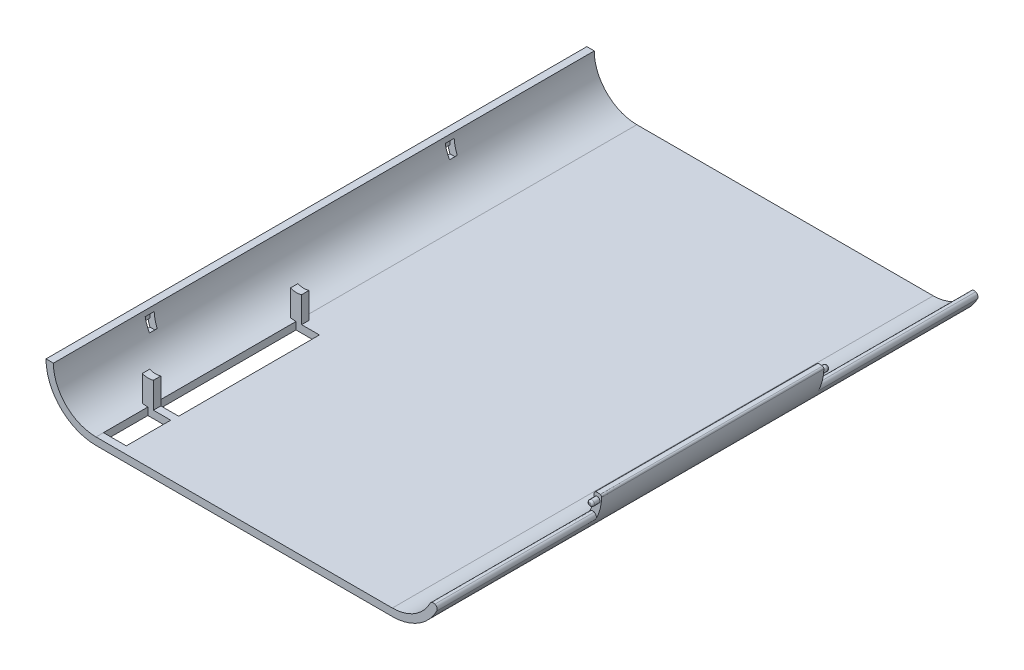
from build123d import *

# Parameters (mm, degrees)
BASE_DEPTH             = 146
HINGE_CUT_DEPTH        = 43
HINGE_START            = -103
HINGE_CUT_2_DEPTH      = 43
HINGE_START_2          = -62
SKETCH3_R              = 0.75
HINGE_EXTRUSIONS_DEPTH = 64
FILLET5_R              = 0.5
FILLET6_R              = 0.5
SYRINGE_START          = -92
SYRINGE_HOLDER_DEPTH   = 2
LPATTERN4_COUNT        = 2
LPATTERN4_PITCH        = 40
FILLET7_R              = 1
FILLET8_R              = 0.5
SNAP_START             = -12.431858348
SNAP_GROOVE1_DEPTH     = 2
SNAP_START_2           = -13.062831461
SNAP_GROOVE1_2_DEPTH   = 0.630973113
LPATTERN5_COUNT        = 2
LPATTERN5_PITCH        = 81
SKETCH6_W              = 6.31577628
SKETCH6_H              = 38
VISIBILITY_DEPTH       = 2
SKETCH7_W              = 6.177782062
SKETCH7_H              = 12
CUT_EXTRUDE4_DEPTH     = 2


# Read off the part's stored shape, not the designer's step: Snap Groove1
with BuildPart() as part:
    # Sketch1 → Base (new body)
    with BuildSketch(Plane.XY):
        with BuildLine():
            Line((0, 0), (80, 0))
            ThreePointArc((80, 0), (89.545941546, 3.954058454), (93.5, 13.5))
            ThreePointArc((93.5, 13.5), (92.5, 13.70219929), (91.5, 13.5))
            ThreePointArc((91.5, 13.5), (88.131727984, 5.368272016), (80, 2))
            Line((80, 2), (0, 2))
            ThreePointArc((0, 2), (-8.131727984, 5.368272016), (-11.5, 13.5))
            Line((-11.5, 13.5), (-13.5, 13.5))
            ThreePointArc((-13.5, 13.5), (-9.545941546, 3.954058454), (0, 0))
        make_face()
    extrude(amount=-BASE_DEPTH)

    # Sketch2 → Hinge cut (cut)
    with BuildSketch(Plane.XY):
        with BuildLine():
            ThreePointArc((93.5, 13.5), (93.179996096, 10.578065212), (92.235155125, 7.794653467))
            ThreePointArc((92.235155125, 7.794653467), (91.53133512, 8.651508178), (90.422539551, 8.63988999))
            ThreePointArc((90.422539551, 8.63988999), (91.227404082, 11.01094444), (91.5, 13.5))
            ThreePointArc((91.5, 13.5), (92.5, 13.914213562), (93.5, 13.5))
        make_face()
    extrude(amount=-HINGE_CUT_DEPTH, mode=Mode.SUBTRACT)

    # Sketch2<2> → Hinge cut 2 (cut)
    with BuildSketch(Plane.XY.offset(HINGE_START)):
        with BuildLine():
            ThreePointArc((93.5, 13.5), (93.179996096, 10.578065212), (92.235155125, 7.794653467))
            ThreePointArc((92.235155125, 7.794653467), (91.53133512, 8.651508178), (90.422539551, 8.63988999))
            ThreePointArc((90.422539551, 8.63988999), (91.227404082, 11.01094444), (91.5, 13.5))
            ThreePointArc((91.5, 13.5), (92.5, 13.914213562), (93.5, 13.5))
        make_face()
    extrude(amount=-HINGE_CUT_2_DEPTH, mode=Mode.SUBTRACT)

    # Sketch3 → hinge extrusions (add)
    with BuildSketch(Plane.XY.offset(-43).offset(HINGE_START_2)):
        with Locations(Location((92.3, 12, 0), (0, 0, 180))):
            Circle(SKETCH3_R)
    extrude(amount=HINGE_EXTRUSIONS_DEPTH)

    # Fillet5
    fillet5_edges = [part.edges().sort_by_distance(p)[0] for p in [
        (93.05, 12, -105),
    ]]
    fillet(fillet5_edges, radius=FILLET5_R)

    # Fillet6
    fillet6_edges = [part.edges().sort_by_distance(p)[0] for p in [
        (93.05, 12, -41),
    ]]
    fillet(fillet6_edges, radius=FILLET6_R)

    # Sketch5 → Syringe holder (add)
    with BuildSketch(Plane(origin=(0, 0, -146), x_dir=(-1, 0, 0), z_dir=(0, 0, -1)).offset(SYRINGE_START)):
        with BuildLine():
            Line((0, 2), (-1.5, 2))
            Line((-1.5, 2), (-1.5, 9))
            ThreePointArc((-1.5, 9), (0.0084764, 8.790290315), (1.5, 9.098245749))
            Line((1.5, 9.098245749), (1.5, 2.098245749))
            ThreePointArc((1.5, 2.098245749), (0.751606983, 2.024587722), (0, 2))
        make_face()
    syringe_holder = extrude(amount=SYRINGE_HOLDER_DEPTH)

    # LPattern4: Syringe holder ×2
    with Locations(*[(0, 0, i * LPATTERN4_PITCH) for i in range(1, LPATTERN4_COUNT)]):
        add(syringe_holder)

    # Fillet7
    fillet7_edges = [part.edges().sort_by_distance(p)[0] for p in [
        (92.235155125, 7.794653467, -21.5),
        (90.422539551, 8.63988999, -21.5),
        (92.235155125, 7.794653467, -124.5),
        (90.422539551, 8.63988999, -124.5),
    ]]
    fillet(fillet7_edges, radius=FILLET7_R - 0.0001)  # a hair under: the kernel refuses the full size

    # Fillet8
    fillet8_edges = [part.edges().sort_by_distance(p)[0] for p in [
        (93.5, 13.5, -73),
        (91.5, 13.5, -73),
    ]]
    fillet(fillet8_edges, radius=FILLET8_R)

    # Snap Groove1 outline → Snap Groove1 (cut)
    with BuildSketch(Plane(origin=(0, 0, 0), x_dir=(0.0006419218138647702, 0.9999997939681713, 0), z_dir=(0.9999997939681713, -0.0006419218138647702, 0)).offset(SNAP_START)):
        Polygon((8.059246911, -107.890634842), (12.059246911, -108.100265959), (12.059246911, -105.681003725), (8.059246911, -105.890634842), align=None)
    snap_groove1 = extrude(amount=SNAP_GROOVE1_DEPTH, mode=Mode.SUBTRACT)

    # Snap Groove1 2 outline → Snap Groove1 2 (cut)
    with BuildSketch(Plane(origin=(0, 0, 0), x_dir=(0.0006419218138647702, 0.9999997939681713, 0), z_dir=(0.9999997939681713, -0.0006419218138647702, 0)).offset(SNAP_START_2)):
        Polygon((8.059246911, -107.890634842), (10.059246911, -107.9954504), (10.059246911, -105.785819283), (8.059246911, -105.890634842), align=None)
    snap_groove1_2 = extrude(amount=SNAP_GROOVE1_2_DEPTH, mode=Mode.SUBTRACT)

    # LPattern5: Snap Groove1, Snap Groove1 2 ×2
    with Locations(*[(0, 0, i * LPATTERN5_PITCH) for i in range(1, LPATTERN5_COUNT)]):
        add(snap_groove1, mode=Mode.SUBTRACT)
        add(snap_groove1_2, mode=Mode.SUBTRACT)

    # Sketch6 → Visibility (cut)
    with BuildSketch(Plane(origin=(0, 2, 0), x_dir=(1, 0, 0), z_dir=(0, 1, 0))):
        with Locations((3.15788814, 35)):
            Rectangle(SKETCH6_W, SKETCH6_H)
    extrude(amount=-VISIBILITY_DEPTH, mode=Mode.SUBTRACT)

    # Sketch7 → Cut-Extrude4 (cut)
    with BuildSketch(Plane(origin=(0, 2, 0), x_dir=(1, 0, 0), z_dir=(0, 1, 0))):
        with Locations((3.088891031, 8)):
            Rectangle(SKETCH7_W, SKETCH7_H)
    extrude(amount=-CUT_EXTRUDE4_DEPTH, mode=Mode.SUBTRACT)


solid = part.part
